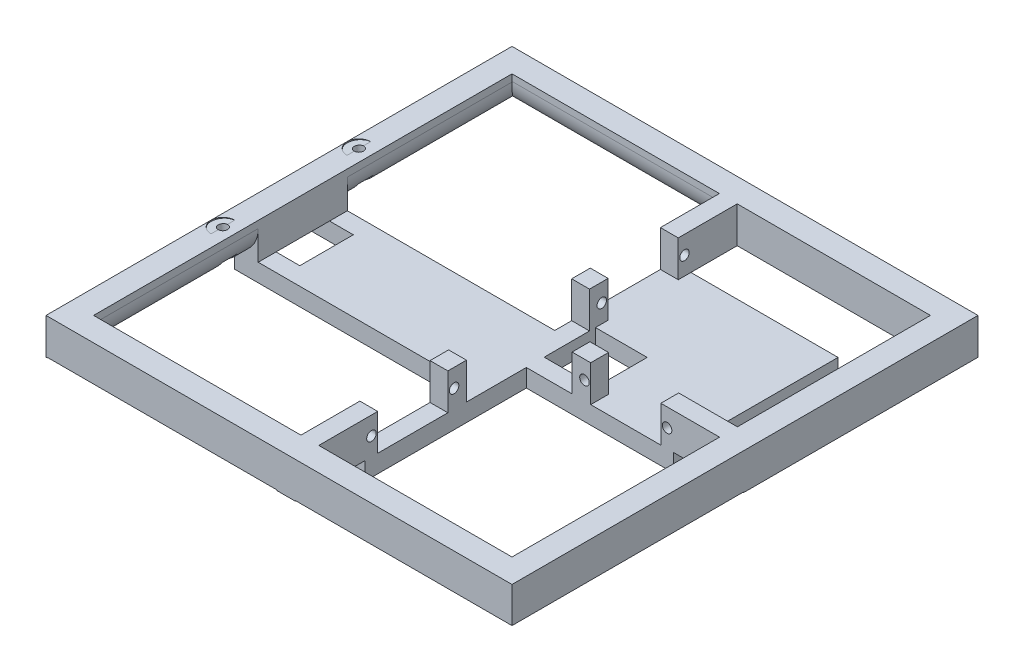
from build123d import *

# Parameters (mm, degrees)
SKETCH_1_W           = 156.75
SKETCH_1_H           = 156.75
SKETCH_1_W_2         = 140.75
SKETCH_1_H_2         = 140.75
EXTRUDE_1_DEPTH      = 12.2
SKETCH_2_W           = 6
SKETCH_2_H           = 12.2
EXTRUDE_2_DEPTH      = 20.25
SKETCH_3_W           = 4.75
SKETCH_3_H           = 6
EXTRUDE_3_DEPTH      = 6
SKETCH_4_W           = 6
SKETCH_4_H           = 6
EXTRUDE_4_DEPTH      = 27.35
SKETCH_6_W           = 4.75
SKETCH_6_H           = 6
EXTRUDE_5_DEPTH      = 12.2
CUT_EXTRUDE_1_REACH  = 113.899
SKETCH_7_R           = 1.6
CUT_EXTRUDE_2_REACH  = 113.899
SKETCH_8_R           = 1.6
SKETCH_9_W           = 6
SKETCH_9_H           = 12.2
EXTRUDE_6_DEPTH      = 20.33
SKETCH_10_W          = 6
SKETCH_10_H          = 12.2
EXTRUDE_7_DEPTH      = 20.33
SKETCH_11_W          = 6
SKETCH_11_H          = 4.755
EXTRUDE_8_DEPTH      = 6
SKETCH_12_W          = 6
SKETCH_12_H          = 4.755
EXTRUDE_9_DEPTH      = 6
EXTRUDE_10_REACH     = 152.941
SKETCH_13_W          = 6
SKETCH_13_H          = 6
EXTRUDE_11_REACH     = 130.541
SKETCH_14_W          = 6
SKETCH_14_H          = 6
SKETCH_15_W          = 6
SKETCH_15_H          = 4.75
EXTRUDE_12_DEPTH     = 12.2
SKETCH_16_W          = 6
SKETCH_16_H          = 4.75
EXTRUDE_13_DEPTH     = 12.2
CUT_EXTRUDE_3_REACH  = 113.949
SKETCH_18_R          = 1.6
CUT_EXTRUDE_4_REACH  = 113.949
SKETCH_20_R          = 1.6
CUT_EXTRUDE_5_REACH  = 113.949
SKETCH_19_R          = 1.6
CUT_EXTRUDE_6_REACH  = 113.949
SKETCH_17_R          = 1.6
CUT_EXTRUDE_7_REACH  = 116.656
SKETCH_22_R          = 3.975
CUT_EXTRUDE_8_REACH  = 116.656
SKETCH_23_R          = 1.55
SKETCH_25_W          = 30
SKETCH_25_H          = 6
EXTRUDE_14_DEPTH     = 77.75
SKETCH_26_W          = 18
SKETCH_26_H          = 6
CUT_EXTRUDE_10_DEPTH = 16
SKETCH_27_W          = 32.1
SKETCH_27_H          = 6
EXTRUDE_18_DEPTH     = 49.36
EXTRUDE_19_REACH     = 117.35
SKETCH_29_W          = 32.1
SKETCH_29_H          = 6
FILLET_3_R           = 10
CUT_EXTRUDE_9_REACH  = 114.725
SKETCH_24_R          = 3.05
SKETCH_30_W          = 6
SKETCH_30_H          = 12.2
CUT_EXTRUDE_11_DEPTH = 0.5
SKETCH_31_W          = 6
SKETCH_31_H          = 12.2
CUT_EXTRUDE_12_DEPTH = 0.5
SKETCH_32_W          = 6
SKETCH_32_H          = 12.2
CUT_EXTRUDE_13_DEPTH = 0.5
SKETCH_33_W          = 6
SKETCH_33_H          = 12.2
CUT_EXTRUDE_14_DEPTH = 0.5
SKETCH_34_W          = 6
SKETCH_34_H          = 12.2
CUT_EXTRUDE_15_DEPTH = 0.5
SKETCH_35_W          = 6
SKETCH_35_H          = 12.2
CUT_EXTRUDE_16_DEPTH = 0.5
SKETCH_36_W          = 6
SKETCH_36_H          = 12.2
EXTRUDE_20_DEPTH     = 2
SKETCH_37_W          = 6
SKETCH_37_H          = 12.2
EXTRUDE_21_DEPTH     = 2
SKETCH_38_W          = 6
SKETCH_38_H          = 12.2
EXTRUDE_22_DEPTH     = 2


with BuildPart() as part:
    # ｽｹｯﾁ1 → ﾎﾞｽ - 押し出し1 (new body)
    with BuildSketch(Plane(origin=(0, 0, 0), x_dir=(1, 0, 0), z_dir=(0, 1, 0))):
        Rectangle(SKETCH_1_W, SKETCH_1_H)
        Rectangle(SKETCH_1_W_2, SKETCH_1_H_2, mode=Mode.SUBTRACT)
    extrude(amount=EXTRUDE_1_DEPTH)



with BuildPart() as body_2:
    # ｽｹｯﾁ2 → ﾎﾞｽ - 押し出し2 (new body)
    with BuildSketch(Plane.ZY.offset(-70.375)):
        with Locations((-2.445, 6.1)):
            Rectangle(SKETCH_2_W, SKETCH_2_H)
    extrude(amount=EXTRUDE_2_DEPTH)


with BuildPart() as part_1:
    add(part.part)

    add(body_2.part)  # ﾎﾞｽ - 押し出し3 merges body 2
    # ｽｹｯﾁ3 → ﾎﾞｽ - 押し出し3 (add)
    with BuildSketch(Plane(origin=(0, 0, 0), x_dir=(-1, 0, 0), z_dir=(0, -1, 0))):
        with Locations((-52.5, 2.445)):
            Rectangle(SKETCH_3_W, SKETCH_3_H)
    extrude(amount=EXTRUDE_3_DEPTH)

    # ｽｹｯﾁ4 → ﾎﾞｽ - 押し出し4 (add)
    with BuildSketch(Plane.ZY.offset(-50.125)):
        with Locations((-2.445, -3)):
            Rectangle(SKETCH_4_W, SKETCH_4_H)
    extrude(amount=EXTRUDE_4_DEPTH)

    # ｽｹｯﾁ6 → ﾎﾞｽ - 押し出し5 (add)
    with BuildSketch(Plane(origin=(0, 0, 0), x_dir=(1, 0, 0), z_dir=(0, 1, 0))):
        with Locations((25.15, 2.445)):
            Rectangle(SKETCH_6_W, SKETCH_6_H)
    extrude(amount=EXTRUDE_5_DEPTH)

    # ｽｹｯﾁ7 → ｶｯﾄ - 押し出し1 (cut, up to next)
    with BuildSketch(Plane.XY.offset(0.555), mode=Mode.PRIVATE) as cut_extrude_1_sk1:
        with Locations((52.725, 6.1)):
            Circle(SKETCH_7_R)
    cut_extrude_1_tool1 = extrude(cut_extrude_1_sk1.sketch, amount=-CUT_EXTRUDE_1_REACH, mode=Mode.PRIVATE) & part_1.part
    add(cut_extrude_1_tool1.solids().sort_by_distance((52.725, 6.1, 0.555))[0], mode=Mode.SUBTRACT)

    # ｽｹｯﾁ8 → ｶｯﾄ - 押し出し2 (cut, up to next)
    with BuildSketch(Plane.XY.offset(0.555), mode=Mode.PRIVATE) as cut_extrude_2_sk1:
        with Locations((24.925, 6.1)):
            Circle(SKETCH_8_R)
    cut_extrude_2_tool1 = extrude(cut_extrude_2_sk1.sketch, amount=-CUT_EXTRUDE_2_REACH, mode=Mode.PRIVATE) & part_1.part
    add(cut_extrude_2_tool1.solids().sort_by_distance((24.925, 6.1, 0.555))[0], mode=Mode.SUBTRACT)

    # ｽｹｯﾁ9 → ﾎﾞｽ - 押し出し6 (add)
    with BuildSketch(Plane.XY.offset(-70.375)):
        with Locations((2.375, 6.1)):
            Rectangle(SKETCH_9_W, SKETCH_9_H)
    extrude(amount=EXTRUDE_6_DEPTH)

    # ｽｹｯﾁ11 → ﾎﾞｽ - 押し出し8 (add)
    with BuildSketch(Plane(origin=(0, 0, 0), x_dir=(1, 0, 0), z_dir=(0, 1, 0))):
        with Locations((2.375, 52.4225)):
            Rectangle(SKETCH_11_W, SKETCH_11_H)
    extrude(amount=-EXTRUDE_8_DEPTH)


with BuildPart() as body_2_2:
    # ｽｹｯﾁ10 → ﾎﾞｽ - 押し出し7 (new body)
    with BuildSketch(Plane(origin=(0, 0, 70.375), x_dir=(-1, 0, 0), z_dir=(0, 0, -1))):
        with Locations((-2.375, 6.1)):
            Rectangle(SKETCH_10_W, SKETCH_10_H)
    extrude(amount=EXTRUDE_7_DEPTH)


    add(part_1.part)  # ﾎﾞｽ - 押し出し9 merges part
    # ｽｹｯﾁ12 → ﾎﾞｽ - 押し出し9 (add)
    with BuildSketch(Plane(origin=(0, 0, 0), x_dir=(1, 0, 0), z_dir=(0, 1, 0))):
        with Locations((2.375, -52.4225)):
            Rectangle(SKETCH_12_W, SKETCH_12_H)
    extrude(amount=-EXTRUDE_9_DEPTH)

    # ｽｹｯﾁ13 → ﾎﾞｽ - 押し出し10 (add, up to next)
    with BuildSketch(Plane(origin=(0, 0, 50.045), x_dir=(-1, 0, 0), z_dir=(0, 0, -1)), mode=Mode.PRIVATE) as extrude_10_sk1:
        with Locations((-2.375, -3)):
            Rectangle(SKETCH_13_W, SKETCH_13_H)
    extrude_10_tool1 = extrude(extrude_10_sk1.sketch, amount=EXTRUDE_10_REACH, mode=Mode.PRIVATE) - body_2_2.part
    add(extrude_10_tool1.solids().sort_by_distance((2.375, -3, 50.045))[0])

    # ｽｹｯﾁ14 → ﾎﾞｽ - 押し出し11 (add, up to next)
    with BuildSketch(Plane.ZY.offset(-22.775), mode=Mode.PRIVATE) as extrude_11_sk1:
        with Locations((-2.445, -3)):
            Rectangle(SKETCH_14_W, SKETCH_14_H)
    extrude_11_tool1 = extrude(extrude_11_sk1.sketch, amount=EXTRUDE_11_REACH, mode=Mode.PRIVATE) - body_2_2.part
    add(extrude_11_tool1.solids().sort_by_distance((22.775, -3, -2.445))[0])

    # ｽｹｯﾁ15 → ﾎﾞｽ - 押し出し12 (add)
    with BuildSketch(Plane(origin=(0, 0, 0), x_dir=(1, 0, 0), z_dir=(0, 1, 0))):
        with Locations((2.375, 25.075)):
            Rectangle(SKETCH_15_W, SKETCH_15_H)
    extrude(amount=EXTRUDE_12_DEPTH)

    # ｽｹｯﾁ16 → ﾎﾞｽ - 押し出し13 (add)
    with BuildSketch(Plane(origin=(0, 0, 0), x_dir=(1, 0, 0), z_dir=(0, 1, 0))):
        with Locations((2.375, -25.075)):
            Rectangle(SKETCH_16_W, SKETCH_16_H)
    extrude(amount=EXTRUDE_13_DEPTH)

    # ｽｹｯﾁ18 → ｶｯﾄ - 押し出し3 (cut, up to next)
    with BuildSketch(Plane.ZY.offset(0.625), mode=Mode.PRIVATE) as cut_extrude_3_sk1:
        with Locations((52.65, 6.1)):
            Circle(SKETCH_18_R)
    cut_extrude_3_tool1 = extrude(cut_extrude_3_sk1.sketch, amount=-CUT_EXTRUDE_3_REACH, mode=Mode.PRIVATE) & body_2_2.part
    add(cut_extrude_3_tool1.solids().sort_by_distance((-0.625, 6.1, 52.65))[0], mode=Mode.SUBTRACT)

    # ｽｹｯﾁ20 → ｶｯﾄ - 押し出し4 (cut, up to next)
    with BuildSketch(Plane.ZY.offset(0.625), mode=Mode.PRIVATE) as cut_extrude_4_sk1:
        with Locations((24.85, 6.1)):
            Circle(SKETCH_20_R)
    cut_extrude_4_tool1 = extrude(cut_extrude_4_sk1.sketch, amount=-CUT_EXTRUDE_4_REACH, mode=Mode.PRIVATE) & body_2_2.part
    add(cut_extrude_4_tool1.solids().sort_by_distance((-0.625, 6.1, 24.85))[0], mode=Mode.SUBTRACT)

    # ｽｹｯﾁ19 → ｶｯﾄ - 押し出し5 (cut, up to next)
    with BuildSketch(Plane.ZY.offset(0.625), mode=Mode.PRIVATE) as cut_extrude_5_sk1:
        with Locations((-24.82028006, 6.1)):
            Circle(SKETCH_19_R)
    cut_extrude_5_tool1 = extrude(cut_extrude_5_sk1.sketch, amount=-CUT_EXTRUDE_5_REACH, mode=Mode.PRIVATE) & body_2_2.part
    add(cut_extrude_5_tool1.solids().sort_by_distance((-0.625, 6.1, -24.82028))[0], mode=Mode.SUBTRACT)

    # ｽｹｯﾁ17 → ｶｯﾄ - 押し出し6 (cut, up to next)
    with BuildSketch(Plane.ZY.offset(0.625), mode=Mode.PRIVATE) as cut_extrude_6_sk1:
        with Locations((-52.65, 6.1)):
            Circle(SKETCH_17_R)
    cut_extrude_6_tool1 = extrude(cut_extrude_6_sk1.sketch, amount=-CUT_EXTRUDE_6_REACH, mode=Mode.PRIVATE) & body_2_2.part
    add(cut_extrude_6_tool1.solids().sort_by_distance((-0.625, 6.1, -52.65))[0], mode=Mode.SUBTRACT)

    # ｽｹｯﾁ22 → ｶｯﾄ - 押し出し7 (cut, up to next)
    with BuildSketch(Plane(origin=(-1.624215569, 18.5648689, 0), x_dir=(0, 0, -1), z_dir=(-0.08715574274765836, 0.9961946980917455, 0)), mode=Mode.PRIVATE) as cut_extrude_7_sk1:
        with Locations((-22.875, 73.028680609)):
            Circle(SKETCH_22_R)
    cut_extrude_7_tool1 = extrude(cut_extrude_7_sk1.sketch, amount=CUT_EXTRUDE_7_REACH, mode=Mode.PRIVATE) & body_2_2.part
    # ｽｹｯﾁ22 → ｶｯﾄ - 押し出し7 (cut, up to next)
    with BuildSketch(Plane(origin=(-1.624215569, 18.5648689, 0), x_dir=(0, 0, -1), z_dir=(-0.08715574274765836, 0.9961946980917455, 0)), mode=Mode.PRIVATE) as cut_extrude_7_sk2:
        with Locations((22.875, 73.028680609)):
            Circle(SKETCH_22_R)
    cut_extrude_7_tool2 = extrude(cut_extrude_7_sk2.sketch, amount=CUT_EXTRUDE_7_REACH, mode=Mode.PRIVATE) & body_2_2.part
    add(cut_extrude_7_tool1.solids().sort_by_distance((-74.375, 12.2, 22.875))[0], mode=Mode.SUBTRACT)
    add(cut_extrude_7_tool2.solids().sort_by_distance((-74.375, 12.2, -22.875))[0], mode=Mode.SUBTRACT)

    # ｶｯﾄ - 押し出し8: up to this plane
    cut_extrude_8_end = Plane(origin=(-0.625, 0, 50.045), z_dir=(0, 1, 0))
    # ｽｹｯﾁ23 → ｶｯﾄ - 押し出し8 (cut, up to the surface)
    with BuildSketch(Plane(origin=(-1.624215569, 18.5648689, 0), x_dir=(0, 0, -1), z_dir=(-0.08715574274765836, 0.9961946980917455, 0)), mode=Mode.PRIVATE) as cut_extrude_8_sk1:
        with Locations(Location((-22.875, 73.028680609, 0), (0, 0, 90))):
            Circle(SKETCH_23_R)
    cut_extrude_8_tool1 = split(extrude(cut_extrude_8_sk1.sketch, amount=-CUT_EXTRUDE_8_REACH, mode=Mode.PRIVATE), bisect_by=cut_extrude_8_end, keep=Keep.BOTH, mode=Mode.PRIVATE)
    add(cut_extrude_8_tool1.solids().sort_by_distance((-74.375, 12.2, 22.875))[0], mode=Mode.SUBTRACT)
    # ｽｹｯﾁ23 → ｶｯﾄ - 押し出し8 (cut, up to the surface)
    with BuildSketch(Plane(origin=(-1.624215569, 18.5648689, 0), x_dir=(0, 0, -1), z_dir=(-0.08715574274765836, 0.9961946980917455, 0)), mode=Mode.PRIVATE) as cut_extrude_8_sk2:
        with Locations(Location((22.875, 73.028680609, 0), (0, 0, 90))):
            Circle(SKETCH_23_R)
    cut_extrude_8_tool2 = split(extrude(cut_extrude_8_sk2.sketch, amount=-CUT_EXTRUDE_8_REACH, mode=Mode.PRIVATE), bisect_by=cut_extrude_8_end, keep=Keep.BOTH, mode=Mode.PRIVATE)
    add(cut_extrude_8_tool2.solids().sort_by_distance((-74.375, 12.2, -22.875))[0], mode=Mode.SUBTRACT)

    # ｽｹｯﾁ25 → ﾎﾞｽ - 押し出し14 (add)
    with BuildSketch(Plane.ZY.offset(0.625)):
        with Locations((0, -3)):
            Rectangle(SKETCH_25_W, SKETCH_25_H)
    extrude(amount=EXTRUDE_14_DEPTH)

    # ｽｹｯﾁ26 → ｶｯﾄ - 押し出し10 (cut)
    with BuildSketch(Plane.ZY.offset(78.375)):
        with Locations((0, -3)):
            Rectangle(SKETCH_26_W, SKETCH_26_H)
    extrude(amount=-CUT_EXTRUDE_10_DEPTH, mode=Mode.SUBTRACT)

    # ｽｹｯﾁ27 → ﾎﾞｽ - 押し出し18 (add)
    with BuildSketch(Plane(origin=(0, 0, -5.445), x_dir=(-1, 0, 0), z_dir=(0, 0, -1))):
        with Locations((-38.825, -3)):
            Rectangle(SKETCH_27_W, SKETCH_27_H)
    extrude(amount=EXTRUDE_18_DEPTH)

    # ｽｹｯﾁ29 → ﾎﾞｽ - 押し出し19 (add, up to next)
    with BuildSketch(Plane(origin=(5.375, 0, 0), x_dir=(0, 0, -1), z_dir=(1, 0, 0)), mode=Mode.PRIVATE) as extrude_19_sk1:
        with Locations((38.75, -3)):
            Rectangle(SKETCH_29_W, SKETCH_29_H)
    extrude_19_tool1 = extrude(extrude_19_sk1.sketch, amount=EXTRUDE_19_REACH, mode=Mode.PRIVATE) - body_2_2.part
    add(extrude_19_tool1.solids().sort_by_distance((5.375, -3, -38.75))[0])

    # ﾌｨﾚｯﾄ3
    # the kernel refuses this fillet: 10 mm, written as the material it takes off along each edge
    with BuildSketch(Plane(origin=(70.375, 0, 70.375), x_dir=(0, 1.4624745858779767e-12, 1.0), z_dir=(-1, 0, 0))) as fillet_3_piece_1:
        with BuildLine():
            CenterArc((FILLET_3_R, FILLET_3_R), FILLET_3_R, 180, 90)
            Line((0, FILLET_3_R), (0, 0))
            Line((0, 0), (FILLET_3_R, 0))
        make_face()
    extrude(amount=65, mode=Mode.SUBTRACT)
    with BuildSketch(Plane(origin=(95.375, 0, 70.375), x_dir=(0, 1.4624745858779767e-12, 1.0), z_dir=(-1, 0, 0))) as fillet_3_piece_2_section:
        with BuildLine():
            CenterArc((FILLET_3_R, FILLET_3_R), FILLET_3_R, 180, 90)
            Line((0, FILLET_3_R), (0, 0))
            Line((0, 0), (FILLET_3_R, 0))
        make_face()
    fillet_3_piece_2 = extrude(amount=115, mode=Mode.PRIVATE)
    fillet_3_piece_2 = split(fillet_3_piece_2, bisect_by=Plane(origin=(-0.625, 0, 70.375), z_dir=(-1, 0, 0)), keep=Keep.TOP, mode=Mode.PRIVATE)
    add(fillet_3_piece_2, mode=Mode.SUBTRACT)
    with BuildSketch(Plane(origin=(24.375, 0, 70.375), x_dir=(0, 1.4624745858779767e-12, 1.0), z_dir=(-1, 0, 0))) as fillet_3_piece_3_section:
        with BuildLine():
            CenterArc((FILLET_3_R, FILLET_3_R), FILLET_3_R, 180, 90)
            Line((0, FILLET_3_R), (0, 0))
            Line((0, 0), (FILLET_3_R, 0))
        make_face()
    fillet_3_piece_3 = extrude(amount=119.75, mode=Mode.PRIVATE)
    fillet_3_piece_3 = split(fillet_3_piece_3, bisect_by=Plane(origin=(5.375, 0, 70.375), z_dir=(1, 0, 0)), keep=Keep.TOP, mode=Mode.PRIVATE)
    add(fillet_3_piece_3, mode=Mode.SUBTRACT)
    with BuildSketch(Plane(origin=(-0.625, 0, 70.375), x_dir=(0, 1.4624745858779767e-12, 1.0), z_dir=(-1, 0, 0)), Plane(origin=(-70.375, 0, -70.375), x_dir=(0, -1.277022931845058e-12, -1.0), z_dir=(1, 0, 0))) as fillet_3_piece_4:
        with BuildLine():
            CenterArc((FILLET_3_R, FILLET_3_R), FILLET_3_R, 180, 90)
            Line((0, FILLET_3_R), (0, 0))
            Line((0, 0), (FILLET_3_R, 0))
        make_face()
    extrude(amount=69.75, mode=Mode.SUBTRACT)
    with BuildSketch(Plane(origin=(-70.375, 0, 70.375), x_dir=(-1, 0, 0), z_dir=(0, 0, -1)), Plane(origin=(-70.375, 0, -15), x_dir=(-1, 0, 0), z_dir=(0, 0, -1))) as fillet_3_piece_5:
        with BuildLine():
            CenterArc((10, 9.797958971), FILLET_3_R, 180, 78.463040967)
            Line((0, 9.797958971), (0, 0))
            Line((0, 0), (8, 0))
        make_face()
    extrude(amount=55.375, mode=Mode.SUBTRACT)
    with BuildSketch(Plane(origin=(70.375, 0, 0.555), x_dir=(1, 0, 0), z_dir=(0, 0, 1))) as fillet_3_piece_6:
        with BuildLine():
            CenterArc((FILLET_3_R, FILLET_3_R), FILLET_3_R, 180, 90)
            Line((0, FILLET_3_R), (0, 0))
            Line((0, 0), (FILLET_3_R, 0))
        make_face()
    extrude(amount=69.82, mode=Mode.SUBTRACT)
    with BuildSketch(Plane(origin=(70.375, 0, 0.555), x_dir=(1, 0, 0), z_dir=(0, 0, 1))) as fillet_3_piece_7a_section:
        with BuildLine():
            CenterArc((FILLET_3_R, FILLET_3_R), FILLET_3_R, 180, 90)
            Line((0, FILLET_3_R), (0, 0))
            Line((0, 0), (FILLET_3_R, 0))
        make_face()
    fillet_3_piece_7a = extrude(amount=94.82, mode=Mode.PRIVATE)
    fillet_3_piece_7a = split(fillet_3_piece_7a, bisect_by=Plane(origin=(78.375, 0, 0.555), z_dir=(-1, 0, 0)), keep=Keep.TOP, mode=Mode.PRIVATE)
    fillet_3_piece_7a = split(fillet_3_piece_7a, bisect_by=Plane(origin=(70.375, 0, 78.375), z_dir=(0, 0, -1)), keep=Keep.TOP, mode=Mode.PRIVATE)
    fillet_3_piece_7a = split(fillet_3_piece_7a, bisect_by=Plane(origin=(70.375, 0, 70.375), z_dir=(0, 0, 1)), keep=Keep.TOP, mode=Mode.PRIVATE)
    with BuildSketch(Plane(origin=(95.375, 0, 70.375), x_dir=(0, 1.4624745858779767e-12, 1.0), z_dir=(-1, 0, 0))) as fillet_3_piece_7b_section:
        with BuildLine():
            CenterArc((FILLET_3_R, FILLET_3_R), FILLET_3_R, 180, 90)
            Line((0, FILLET_3_R), (0, 0))
            Line((0, 0), (FILLET_3_R, 0))
        make_face()
    fillet_3_piece_7b = extrude(amount=90, mode=Mode.PRIVATE)
    fillet_3_piece_7b = split(fillet_3_piece_7b, bisect_by=Plane(origin=(78.375, 0, 70.375), z_dir=(-1, 0, 0)), keep=Keep.TOP, mode=Mode.PRIVATE)
    fillet_3_piece_7b = split(fillet_3_piece_7b, bisect_by=Plane(origin=(95.375, 0, 78.375), z_dir=(0, 0, -1)), keep=Keep.TOP, mode=Mode.PRIVATE)
    fillet_3_piece_7b = split(fillet_3_piece_7b, bisect_by=Plane(origin=(70.375, 0, 70.375), z_dir=(1, 0, 0)), keep=Keep.TOP, mode=Mode.PRIVATE)
    fillet_3_piece_7 = fillet_3_piece_7a & fillet_3_piece_7b
    add(fillet_3_piece_7, mode=Mode.SUBTRACT)
    with BuildSketch(Plane(origin=(-0.625, 0, 70.375), x_dir=(0, 1.4624745858779767e-12, 1.0), z_dir=(-1, 0, 0))) as fillet_3_piece_8a_section:
        with BuildLine():
            CenterArc((FILLET_3_R, FILLET_3_R), FILLET_3_R, 180, 90)
            Line((0, FILLET_3_R), (0, 0))
            Line((0, 0), (FILLET_3_R, 0))
        make_face()
    fillet_3_piece_8a = extrude(amount=94.75, mode=Mode.PRIVATE)
    fillet_3_piece_8a = split(fillet_3_piece_8a, bisect_by=Plane(origin=(-0.625, 0, 78.375), z_dir=(0, 0, -1)), keep=Keep.TOP, mode=Mode.PRIVATE)
    fillet_3_piece_8a = split(fillet_3_piece_8a, bisect_by=Plane(origin=(-70.375, 0, 70.375), z_dir=(-1, 0, 0)), keep=Keep.TOP, mode=Mode.PRIVATE)
    fillet_3_piece_8a = split(fillet_3_piece_8a, bisect_by=Plane(origin=(-78.375, 0, 70.375), z_dir=(1, 0, 0)), keep=Keep.TOP, mode=Mode.PRIVATE)
    with BuildSketch(Plane(origin=(-70.375, 0, 94.869897428), x_dir=(-1, 0, 0), z_dir=(0, 0, -1))) as fillet_3_piece_8b_section:
        with BuildLine():
            CenterArc((10, 9.797958971), FILLET_3_R, 180, 78.463040967)
            Line((0, 9.797958971), (0, 0))
            Line((0, 0), (8, 0))
        make_face()
    fillet_3_piece_8b = extrude(amount=79.869897428, mode=Mode.PRIVATE)
    fillet_3_piece_8b = split(fillet_3_piece_8b, bisect_by=Plane(origin=(-70.375, 0, 78.375), z_dir=(0, 0, -1)), keep=Keep.TOP, mode=Mode.PRIVATE)
    fillet_3_piece_8b = split(fillet_3_piece_8b, bisect_by=Plane(origin=(-70.375, 0, 70.375), z_dir=(0, 0, 1)), keep=Keep.TOP, mode=Mode.PRIVATE)
    fillet_3_piece_8 = fillet_3_piece_8a & fillet_3_piece_8b
    add(fillet_3_piece_8, mode=Mode.SUBTRACT)
    with BuildSketch(Plane(origin=(-70.375, 0, -15), x_dir=(-1, 0, 0), z_dir=(0, 0, -1))) as fillet_3_piece_9a_section:
        with BuildLine():
            CenterArc((10, 9.797958971), FILLET_3_R, 180, 78.463040967)
            Line((0, 9.797958971), (0, 0))
            Line((0, 0), (8, 0))
        make_face()
    fillet_3_piece_9a = extrude(amount=79.869897428, mode=Mode.PRIVATE)
    fillet_3_piece_9a = split(fillet_3_piece_9a, bisect_by=Plane(origin=(-70.375, 0, -78.375), z_dir=(0, 0, 1)), keep=Keep.TOP, mode=Mode.PRIVATE)
    fillet_3_piece_9a = split(fillet_3_piece_9a, bisect_by=Plane(origin=(-70.375, 0, -70.375), z_dir=(0, 0, -1)), keep=Keep.TOP, mode=Mode.PRIVATE)
    with BuildSketch(Plane(origin=(-95.375, 0, -70.375), x_dir=(0, -1.277022931845058e-12, -1.0), z_dir=(1, 0, 0))) as fillet_3_piece_9b_section:
        with BuildLine():
            CenterArc((FILLET_3_R, FILLET_3_R), FILLET_3_R, 180, 90)
            Line((0, FILLET_3_R), (0, 0))
            Line((0, 0), (FILLET_3_R, 0))
        make_face()
    fillet_3_piece_9b = extrude(amount=94.75, mode=Mode.PRIVATE)
    fillet_3_piece_9b = split(fillet_3_piece_9b, bisect_by=Plane(origin=(-95.375, 0, -78.375), z_dir=(0, 0, 1)), keep=Keep.TOP, mode=Mode.PRIVATE)
    fillet_3_piece_9b = split(fillet_3_piece_9b, bisect_by=Plane(origin=(-70.375, 0, -70.375), z_dir=(-1, 0, 0)), keep=Keep.TOP, mode=Mode.PRIVATE)
    fillet_3_piece_9b = split(fillet_3_piece_9b, bisect_by=Plane(origin=(-78.375, 0, -70.375), z_dir=(1, 0, 0)), keep=Keep.TOP, mode=Mode.PRIVATE)
    fillet_3_piece_9 = fillet_3_piece_9a & fillet_3_piece_9b
    add(fillet_3_piece_9, mode=Mode.SUBTRACT)

    # ｽｹｯﾁ24 → ｶｯﾄ - 押し出し9 (cut, up to next)
    with BuildSketch(Plane(origin=(-0.926969627, 10.595311316, 0), x_dir=(0, 0, -1), z_dir=(-0.08715574274765836, 0.9961946980917455, 0)), mode=Mode.PRIVATE) as cut_extrude_9_sk1:
        with Locations((-22.875, 73.028680609)):
            Circle(SKETCH_24_R)
    cut_extrude_9_tool1 = extrude(cut_extrude_9_sk1.sketch, amount=-CUT_EXTRUDE_9_REACH, mode=Mode.PRIVATE) & body_2_2.part
    # ｽｹｯﾁ24 → ｶｯﾄ - 押し出し9 (cut, up to next)
    with BuildSketch(Plane(origin=(-0.926969627, 10.595311316, 0), x_dir=(0, 0, -1), z_dir=(-0.08715574274765836, 0.9961946980917455, 0)), mode=Mode.PRIVATE) as cut_extrude_9_sk2:
        with Locations((22.875, 73.028680609)):
            Circle(SKETCH_24_R)
    cut_extrude_9_tool2 = extrude(cut_extrude_9_sk2.sketch, amount=-CUT_EXTRUDE_9_REACH, mode=Mode.PRIVATE) & body_2_2.part
    add(cut_extrude_9_tool1.solids().sort_by_distance((-73.677754, 4.230442, 22.875))[0], mode=Mode.SUBTRACT)
    add(cut_extrude_9_tool2.solids().sort_by_distance((-73.677754, 4.230442, -22.875))[0], mode=Mode.SUBTRACT)

    # ｽｹｯﾁ30 → ｶｯﾄ - 押し出し11 (cut)
    with BuildSketch(Plane.ZY.offset(-50.125)):
        with Locations((-2.445, 6.1)):
            Rectangle(SKETCH_30_W, SKETCH_30_H)
    extrude(amount=-CUT_EXTRUDE_11_DEPTH, mode=Mode.SUBTRACT)

    # ｽｹｯﾁ31 → ｶｯﾄ - 押し出し12 (cut)
    with BuildSketch(Plane(origin=(27.525, 0, 0), x_dir=(0, 0, -1), z_dir=(1, 0, 0))):
        with Locations((2.445, 6.1)):
            Rectangle(SKETCH_31_W, SKETCH_31_H)
    extrude(amount=-CUT_EXTRUDE_12_DEPTH, mode=Mode.SUBTRACT)

    # ｽｹｯﾁ32 → ｶｯﾄ - 押し出し13 (cut)
    with BuildSketch(Plane.XY.offset(27.45)):
        with Locations((2.375, 6.1)):
            Rectangle(SKETCH_32_W, SKETCH_32_H)
    extrude(amount=-CUT_EXTRUDE_13_DEPTH, mode=Mode.SUBTRACT)

    # ｽｹｯﾁ33 → ｶｯﾄ - 押し出し14 (cut)
    with BuildSketch(Plane(origin=(0, 0, 50.045), x_dir=(-1, 0, 0), z_dir=(0, 0, -1))):
        with Locations((-2.375, 6.1)):
            Rectangle(SKETCH_33_W, SKETCH_33_H)
    extrude(amount=-CUT_EXTRUDE_14_DEPTH, mode=Mode.SUBTRACT)

    # ｽｹｯﾁ34 → ｶｯﾄ - 押し出し15 (cut)
    with BuildSketch(Plane(origin=(0, 0, -27.45), x_dir=(-1, 0, 0), z_dir=(0, 0, -1))):
        with Locations((-2.375, 6.1)):
            Rectangle(SKETCH_34_W, SKETCH_34_H)
    extrude(amount=-CUT_EXTRUDE_15_DEPTH, mode=Mode.SUBTRACT)

    # ｽｹｯﾁ35 → ｶｯﾄ - 押し出し16 (cut)
    with BuildSketch(Plane.XY.offset(-50.045)):
        with Locations((2.375, 6.1)):
            Rectangle(SKETCH_35_W, SKETCH_35_H)
    extrude(amount=-CUT_EXTRUDE_16_DEPTH, mode=Mode.SUBTRACT)

    # ｽｹｯﾁ36 → ﾎﾞｽ - 押し出し20 (add)
    with BuildSketch(Plane(origin=(0, 0, 22.7), x_dir=(-1, 0, 0), z_dir=(0, 0, -1))):
        with Locations((-2.375, 6.1)):
            Rectangle(SKETCH_36_W, SKETCH_36_H)
    extrude(amount=EXTRUDE_20_DEPTH)

    # ｽｹｯﾁ37 → ﾎﾞｽ - 押し出し21 (add)
    with BuildSketch(Plane.XY.offset(-22.7)):
        with Locations((2.375, 6.1)):
            Rectangle(SKETCH_37_W, SKETCH_37_H)
    extrude(amount=EXTRUDE_21_DEPTH)

    # ｽｹｯﾁ38 → ﾎﾞｽ - 押し出し22 (add)
    with BuildSketch(Plane.ZY.offset(-22.775)):
        with Locations((-2.445, 6.1)):
            Rectangle(SKETCH_38_W, SKETCH_38_H)
    extrude(amount=EXTRUDE_22_DEPTH)


solid = body_2_2.part
